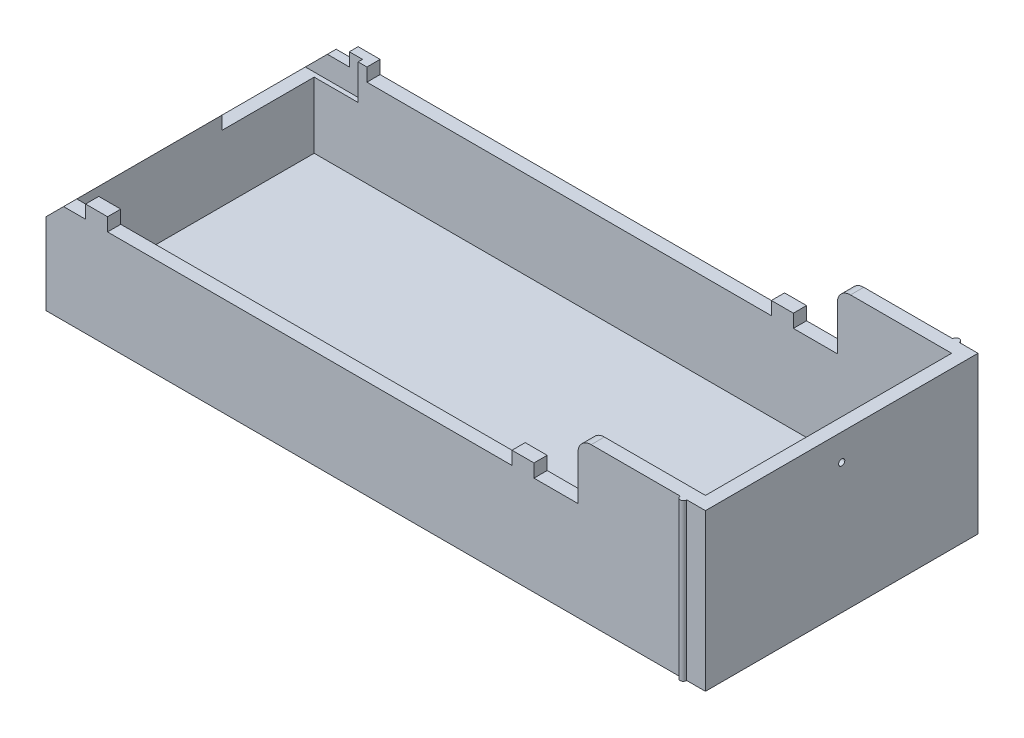
from build123d import *

# Parameters (mm, degrees)
ESBO_O1_W                  = 151
ESBO_O1_H                  = 62
RESSALTO_EXTRUS_O1_DEPTH   = 35.6
ESBO_O2_W                  = 145
ESBO_O2_H                  = 56
CORTE_EXTRUS_O1_DEPTH      = 33.1
ESBO_O3_W                  = 122
ESBO_O3_H                  = 62
CORTE_EXTRUS_O2_DEPTH      = 13.1
CHANFRO1_SIZE              = 5
ESBO_O7_R                  = 0.7
CORTE_EXTRUS_O6_DEPTH      = 3
ESBO_O6_R                  = 0.75
RESSALTO_EXTRUS_O2_DEPTH   = 35.6
FILETE1_R                  = 3
CHANFRO2_SIZE              = 1
ESBO_O8_W                  = 5
ESBO_O8_H                  = 3
RESSALTO_EXTRUS_O3_DEPTH   = 3
CORTE_EXTRUS_O7_DEPTH      = 3
CORTE_EXTRUS_O7_DEPTH_BACK = 5
ESBO_O9_W                  = 13
ESBO_O9_H                  = 22


with BuildPart() as part:
    # Esboço1 → Ressalto-extrusão1 (new body)
    with BuildSketch(Plane(origin=(0, 0, 0), x_dir=(1, 0, 0), z_dir=(0, 1, 0))):
        with Locations((75.5, 31)):
            Rectangle(ESBO_O1_W, ESBO_O1_H)
    extrude(amount=RESSALTO_EXTRUS_O1_DEPTH)

    # Esboço2 → Corte-extrusão1 (cut)
    with BuildSketch(Plane(origin=(0, 35.6, 0), x_dir=(1, 0, 0), z_dir=(0, 1, 0))):
        with Locations((75.5, 31)):
            Rectangle(ESBO_O2_W, ESBO_O2_H)
    extrude(amount=-CORTE_EXTRUS_O1_DEPTH, mode=Mode.SUBTRACT)

    # Esboço3 → Corte-extrusão2 (cut)
    with BuildSketch(Plane(origin=(0, 35.6, 0), x_dir=(1, 0, 0), z_dir=(0, 1, 0))):
        with Locations((61, 31)):
            Rectangle(ESBO_O3_W, ESBO_O3_H)
    extrude(amount=-CORTE_EXTRUS_O2_DEPTH, mode=Mode.SUBTRACT)

    # Chanfro1
    # the kernel refuses this chamfer: 5 mm, written as the material it takes off along each edge
    with BuildSketch(Plane(origin=(0, 22.5, -74.85841494), x_dir=(0.9996219169112968, 0.027495876610586317, 0), z_dir=(0, 0, 1))) as chanfro1_piece_1:
        Polygon((CHANFRO1_SIZE * 0.999621916911, -CHANFRO1_SIZE * 0.0274958766106), (-CHANFRO1_SIZE * 0.0274958766106, -CHANFRO1_SIZE * 0.999621916911), (0, 0), align=None)
    extrude(amount=87.71682988, mode=Mode.SUBTRACT)

    # Esboço7 → Corte-extrusão6 (cut)
    with BuildSketch(Plane(origin=(151, 0, 0), x_dir=(0, 0, -1), z_dir=(1, 0, 0))):
        with Locations((31, 29.6)):
            Circle(ESBO_O7_R)
    extrude(amount=-CORTE_EXTRUS_O6_DEPTH, mode=Mode.SUBTRACT)

    # Esboço6 → Ressalto-extrusão2 (add)
    with BuildSketch(Plane(origin=(0, 35.6, 0), x_dir=(1, 0, 0), z_dir=(0, 1, 0))):
        with Locations((146, 62)):
            Circle(ESBO_O6_R)
        with Locations((146, 0)):
            Circle(ESBO_O6_R)
    extrude(amount=-RESSALTO_EXTRUS_O2_DEPTH)

    # Filete1
    filete1_edges = [part.edges().sort_by_distance(p)[0] for p in [
        (122, 35.6, -60.5),
        (122, 35.6, -1.5),
    ]]
    fillet(filete1_edges, radius=FILETE1_R)

    # Chanfro2
    chanfro2_edges = [part.edges().sort_by_distance(p)[0] for p in [
        (0, 8.75, 0),
        (0, 8.75, -62),
        (0, 0, -31),
    ]]
    chamfer(chanfro2_edges, length=CHANFRO2_SIZE)

    # Esboço8 → Ressalto-extrusão3 (add)
    with BuildSketch(Plane(origin=(0, 22.5, 0), x_dir=(1, 0, 0), z_dir=(0, 1, 0))):
        with Locations((12.5, 60.5)):
            Rectangle(ESBO_O8_W, ESBO_O8_H)
        with Locations((12.5, 1.5)):
            Rectangle(ESBO_O8_W, ESBO_O8_H)
        with Locations((109.5, 60.5)):
            Rectangle(ESBO_O8_W, ESBO_O8_H)
        with Locations((109.5, 1.5)):
            Rectangle(ESBO_O8_W, ESBO_O8_H)
    extrude(amount=RESSALTO_EXTRUS_O3_DEPTH)

    # Esboço9 → Corte-extrusão7 (cut, two sides: drawn at the far end of the back side and taken through both)
    with BuildSketch(Plane(origin=(0, 22.5, 0), x_dir=(1, 0, 0), z_dir=(0, 1, 0)).offset(-CORTE_EXTRUS_O7_DEPTH_BACK)):
        with Locations((6.5, 49)):
            Rectangle(ESBO_O9_W, ESBO_O9_H)
    extrude(amount=CORTE_EXTRUS_O7_DEPTH + CORTE_EXTRUS_O7_DEPTH_BACK, mode=Mode.SUBTRACT)


solid = part.part
